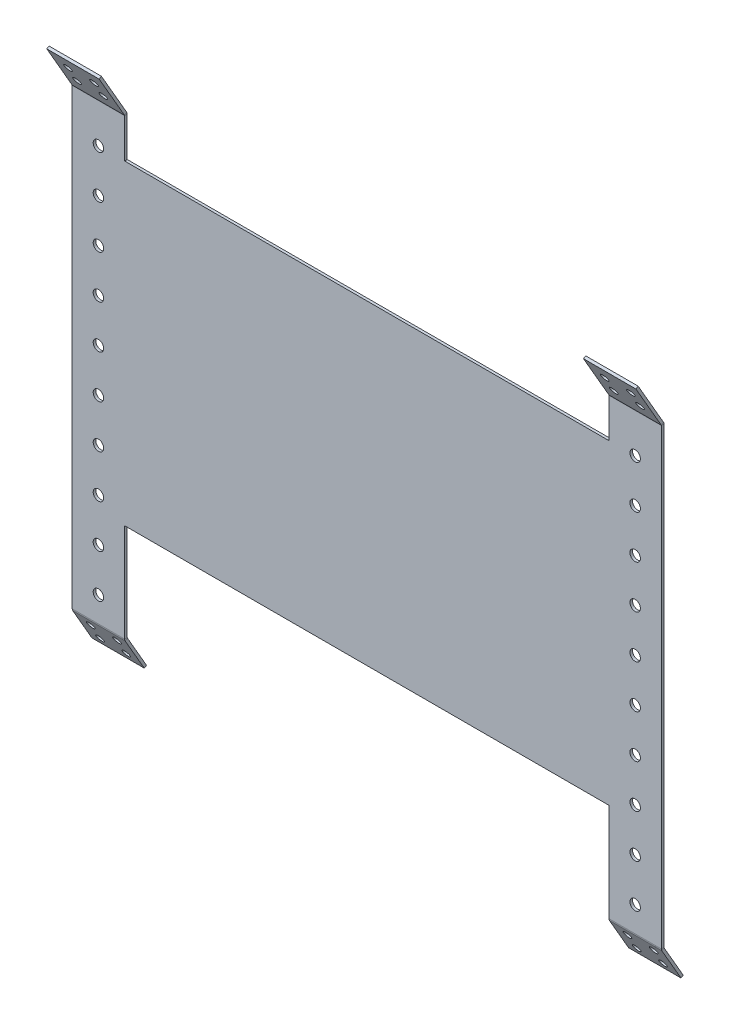
from build123d import *

# Parameters (mm, degrees)
BASE_FLANGE1_DEPTH      = 2
EDGE_FLANGE1_DEPTH      = 40
EDGE_FLANGE1_BEND_DEPTH = 40
EDGE_FLANGE2_DEPTH      = 40
EDGE_FLANGE2_BEND_DEPTH = 40
SKETCH28_R              = 4
CUT_EXTRUDE1_DEPTH      = 2
SKETCH29_R              = 3
CUT_EXTRUDE2_DEPTH      = 2
SKETCH30_R              = 3
CUT_EXTRUDE3_DEPTH      = 2


# Sheet-metal steps are written as plain solids
with BuildPart() as part:
    # Sketch1 → Base-Flange1 (new body)
    with BuildSketch(Plane.XY):
        Polygon((-225, 173.125), (-225, -173.125), (-185, -173.125), (-185, -98.125), (185, -98.125), (185, -173.125), (225, -173.125), (225, 173.125), (185, 173.125), (185, 143.125), (-185, 143.125), (-185, 173.125), align=None)
    extrude(amount=-BASE_FLANGE1_DEPTH)

    # Edge-Flange1 section (across the edge) → Edge-Flange1 (add)
    with BuildSketch(Plane(origin=(-185, 173.339359354, 0), x_dir=(0, -0.49999999999999495, 0.8660254037844416), z_dir=(-1, 0, 0))):
        with BuildLine():
            Line((-2, 0.214359354), (-2, 38.954101615))
            Line((-2, 38.954101615), (0, 38.954101615))
            Line((0, 38.954101615), (0, 0.214359354))
            ThreePointArc((0, 0.214359354), (0.027259339, 0.007304118), (0.107179677, -0.185640646))
            Line((0.107179677, -0.185640646), (-1.624871131, -1.185640646))
            ThreePointArc((-1.624871131, -1.185640646), (-1.904592314, -0.510333972), (-2, 0.214359354))
        make_face()
    extrude(amount=EDGE_FLANGE1_DEPTH)

    # Edge-Flange1 section 2 (across the edge) → Edge-Flange1 bend (add)
    with BuildSketch(Plane(origin=(225, 173.339359354, 0), x_dir=(0, -0.49999999999999495, 0.8660254037844416), z_dir=(-1, 0, 0))):
        with BuildLine():
            Line((-2, 0.214359354), (-2, 38.954101615))
            Line((-2, 38.954101615), (0, 38.954101615))
            Line((0, 38.954101615), (0, 0.214359354))
            ThreePointArc((0, 0.214359354), (0.027259339, 0.007304118), (0.107179677, -0.185640646))
            Line((0.107179677, -0.185640646), (-1.624871131, -1.185640646))
            ThreePointArc((-1.624871131, -1.185640646), (-1.904592314, -0.510333972), (-2, 0.214359354))
        make_face()
    extrude(amount=EDGE_FLANGE1_BEND_DEPTH)

    # Edge-Flange2 section (across the edge) → Edge-Flange2 (add)
    with BuildSketch(Plane(origin=(-185, -173.339359354, -2), x_dir=(0, 0.49999999999999495, -0.8660254037844416), z_dir=(-1, 0, 0))):
        with BuildLine():
            Line((-2, 0.214359354), (-2, 29.464101615))
            Line((-2, 29.464101615), (0, 29.464101615))
            Line((0, 29.464101615), (0, 0.214359354))
            ThreePointArc((0, 0.214359354), (0.027259339, 0.007304118), (0.107179677, -0.185640646))
            Line((0.107179677, -0.185640646), (-1.624871131, -1.185640646))
            ThreePointArc((-1.624871131, -1.185640646), (-1.904592314, -0.510333972), (-2, 0.214359354))
        make_face()
    extrude(amount=EDGE_FLANGE2_DEPTH)

    # Edge-Flange2 section 2 (across the edge) → Edge-Flange2 bend (add)
    with BuildSketch(Plane(origin=(225, -173.339359354, -2), x_dir=(-1.3877787807814315e-15, 0.49999999999999495, -0.8660254037844416), z_dir=(-1, 0, 0))):
        with BuildLine():
            Line((-2, 0.214359354), (-2, 29.464101615))
            Line((-2, 29.464101615), (0, 29.464101615))
            Line((0, 29.464101615), (0, 0.214359354))
            ThreePointArc((0, 0.214359354), (0.027259339, 0.007304118), (0.107179677, -0.185640646))
            Line((0.107179677, -0.185640646), (-1.624871131, -1.185640646))
            ThreePointArc((-1.624871131, -1.185640646), (-1.904592314, -0.510333972), (-2, 0.214359354))
        make_face()
    extrude(amount=EDGE_FLANGE2_BEND_DEPTH)

    # Sketch28 → Cut-Extrude1 (cut)
    with BuildSketch(Plane.XY):
        with Locations((-205, 143.125)):
            Circle(SKETCH28_R)
        with Locations((-205, 110.125)):
            Circle(SKETCH28_R)
        with Locations((-205, 77.125)):
            Circle(SKETCH28_R)
        with Locations((-205, 44.125)):
            Circle(SKETCH28_R)
        with Locations((-205, 11.125)):
            Circle(SKETCH28_R)
        with Locations((-205, -21.875)):
            Circle(SKETCH28_R)
        with Locations((-205, -54.875)):
            Circle(SKETCH28_R)
        with Locations((-205, -87.875)):
            Circle(SKETCH28_R)
        with Locations((-205, -120.875)):
            Circle(SKETCH28_R)
        with Locations((-205, -153.875)):
            Circle(SKETCH28_R)
        with Locations(Location((205, -153.875, 0), (0, 0, 180))):
            Circle(SKETCH28_R)
        with Locations(Location((205, -120.875, 0), (0, 0, 180))):
            Circle(SKETCH28_R)
        with Locations(Location((205, -87.875, 0), (0, 0, 180))):
            Circle(SKETCH28_R)
        with Locations(Location((205, -54.875, 0), (0, 0, 180))):
            Circle(SKETCH28_R)
        with Locations(Location((205, -21.875, 0), (0, 0, 180))):
            Circle(SKETCH28_R)
        with Locations(Location((205, 11.125, 0), (0, 0, 180))):
            Circle(SKETCH28_R)
        with Locations(Location((205, 44.125, 0), (0, 0, 180))):
            Circle(SKETCH28_R)
        with Locations(Location((205, 77.125, 0), (0, 0, 180))):
            Circle(SKETCH28_R)
        with Locations(Location((205, 110.125, 0), (0, 0, 180))):
            Circle(SKETCH28_R)
        with Locations(Location((205, 143.125, 0), (0, 0, 180))):
            Circle(SKETCH28_R)
    extrude(amount=-CUT_EXTRUDE1_DEPTH, mode=Mode.SUBTRACT)

    # Sketch29 → Cut-Extrude2 (cut)
    with BuildSketch(Plane(origin=(0, -43.468814435, 75.290195146), x_dir=(1, 0, 0), z_dir=(0, -0.49999999999999517, 0.8660254037844416))):
        with Locations(Location((-215, -158.955519161, 0), (0, 0, 270))):
            Circle(SKETCH29_R)
        with Locations(Location((-215, -172.955519161, 0), (0, 0, 270))):
            Circle(SKETCH29_R)
        with Locations(Location((-195, -172.955519161, 0), (0, 0, 90))):
            Circle(SKETCH29_R)
        with Locations(Location((-195, -158.955519161, 0), (0, 0, 90))):
            Circle(SKETCH29_R)
        with Locations(Location((195, -172.955519161, 0), (0, 0, 270))):
            Circle(SKETCH29_R)
        with Locations(Location((195, -158.955519161, 0), (0, 0, 270))):
            Circle(SKETCH29_R)
        with Locations(Location((215, -158.955519161, 0), (0, 0, 90))):
            Circle(SKETCH29_R)
        with Locations(Location((215, -172.955519161, 0), (0, 0, 90))):
            Circle(SKETCH29_R)
    extrude(amount=-CUT_EXTRUDE2_DEPTH, mode=Mode.SUBTRACT)

    # Sketch30 → Cut-Extrude3 (cut)
    with BuildSketch(Plane(origin=(0, 44.334839838, -76.790195146), x_dir=(-1, 0, 0), z_dir=(0, 0.499999999999995, -0.8660254037844416))):
        with Locations(Location((-215, 176.700519161, 0), (0, 0, 90))):
            Circle(SKETCH30_R)
        with Locations(Location((-215, 162.700519161, 0), (0, 0, 90))):
            Circle(SKETCH30_R)
        with Locations(Location((-195, 162.700519161, 0), (0, 0, 270))):
            Circle(SKETCH30_R)
        with Locations(Location((-195, 176.700519161, 0), (0, 0, 270))):
            Circle(SKETCH30_R)
        with Locations(Location((195, 162.700519161, 0), (0, 0, 90))):
            Circle(SKETCH30_R)
        with Locations(Location((195, 176.700519161, 0), (0, 0, 90))):
            Circle(SKETCH30_R)
        with Locations(Location((215, 176.700519161, 0), (0, 0, 270))):
            Circle(SKETCH30_R)
        with Locations(Location((215, 162.700519161, 0), (0, 0, 270))):
            Circle(SKETCH30_R)
    extrude(amount=-CUT_EXTRUDE3_DEPTH, mode=Mode.SUBTRACT)


solid = part.part
